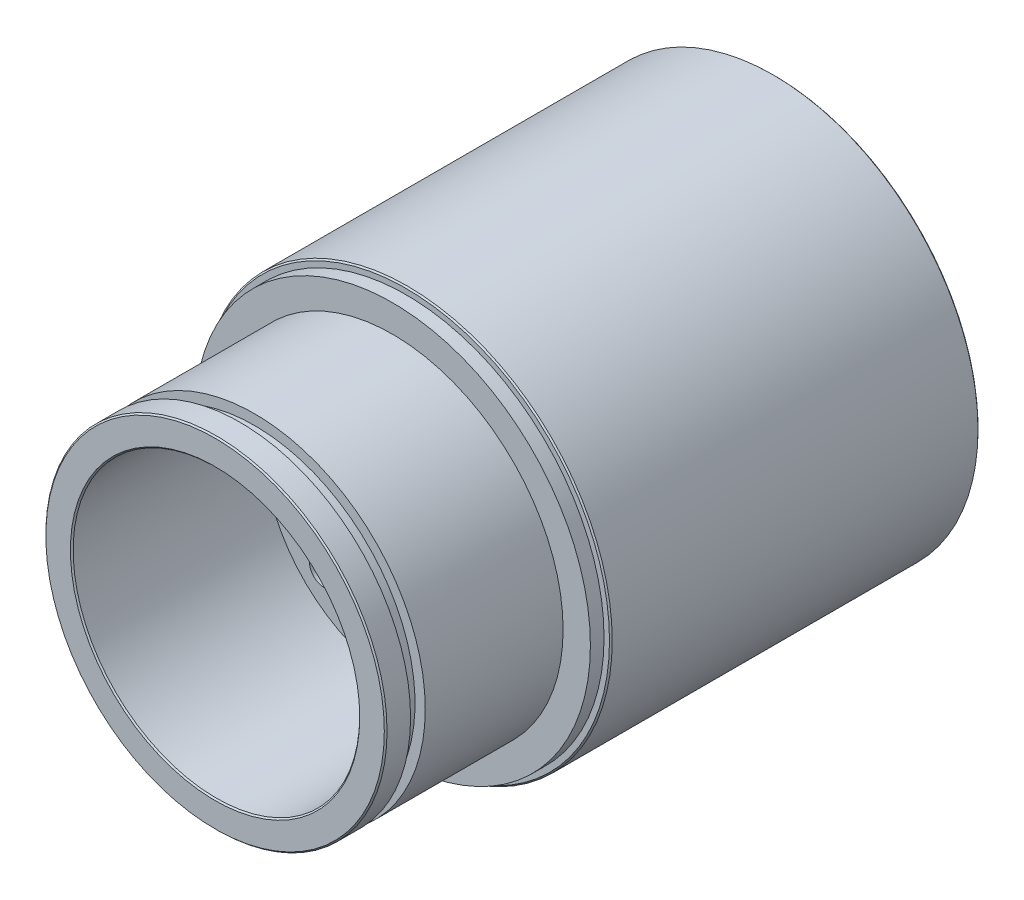
from build123d import *

# Parameters (mm, degrees)
SKETCH2_W            = 1.5
SKETCH2_H            = 2.15
CHAMFER1_SIZE        = 0.2
M4_CLEARANCE_HOLE1_D = 4.3
CIRPATTERN1_COUNT    = 4
CIRPATTERN3_COUNT    = 6


with BuildPart() as part:
    # Sketch1 → Revolve1 (revolve)
    with BuildSketch(Plane(origin=(0, 0, 0), x_dir=(1, 0, 0), z_dir=(0, 1, 0))):
        Polygon((13, 0), (21, 0), (21, -28), (25, -28), (25, -2), (29, -2), (29, 0), (30, 0), (30, 54), (20.5, 54), (20.5, 4), (13, 4), align=None)
    revolve(axis=Axis((0, 0, 0), (0, 0, -1)))

    # Sketch2 → Cut-Revolve1 (revolve, cut)
    with BuildSketch(Plane(origin=(0, 0, 0), x_dir=(1, 0, 0), z_dir=(0, 1, 0))):
        with Locations((24.25, -23.275)):
            Rectangle(SKETCH2_W, SKETCH2_H)
    revolve(axis=Axis((0, 0, 0), (0, 0, 1)), mode=Mode.SUBTRACT)

    # Chamfer1
    chamfer1_edges = [part.edges().sort_by_distance(p)[0] for p in [
        (-30, 0, 0),
        (-20.5, 0, -54),
        (-25, 0, 28),
        (-21, 0, 28),
        (-30, 0, -54),
    ]]
    chamfer(chamfer1_edges, length=CHAMFER1_SIZE)

    # M4 Clearance Hole1 (through all)
    with Locations(Plane.XY):
        with Locations((-12.02081528, 12.02081528)):
            m4_clearance_hole1 = Hole(M4_CLEARANCE_HOLE1_D / 2)

    # CirPattern1: M4 Clearance Hole1 ×4 about axis
    cirpattern1_axis = Axis((0, 0, 0), (0, 0, 1))
    for i in range(1, CIRPATTERN1_COUNT):
        add(m4_clearance_hole1.rotate(cirpattern1_axis, i * 360 / CIRPATTERN1_COUNT), mode=Mode.SUBTRACT)

    # Sketch9 → M4 Tapped Hole1 (revolve, cut)
    with BuildSketch(Plane(origin=(0, 25, -54), x_dir=(0, 1, 0), z_dir=(1, 0, 0))):
        Polygon((0, 0), (0, 11.091420021), (1.65, 10.1), (1.65, 0), align=None)
    m4_tapped_hole1 = revolve(axis=Axis((0, 25, -60.35), (0, 0, 1)), mode=Mode.SUBTRACT)

    # CirPattern3: M4 Tapped Hole1 ×6 about axis
    cirpattern3_axis = Axis((0, 0, 0), (0, 0, 1))
    for i in range(1, CIRPATTERN3_COUNT):
        add(m4_tapped_hole1.rotate(cirpattern3_axis, i * 360 / CIRPATTERN3_COUNT), mode=Mode.SUBTRACT)


solid = part.part
